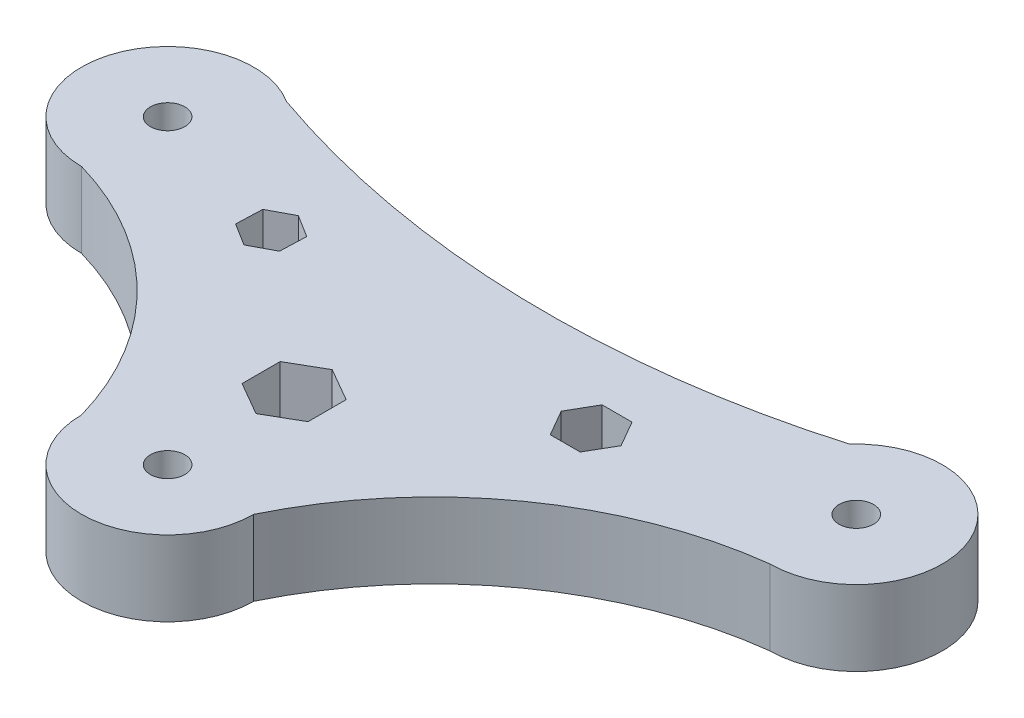
from build123d import *

# Parameters (mm, degrees)
BOSS_EXTRUDE2_OUTLINE_R = 1.6
BOSS_EXTRUDE2_DEPTH     = 7
CUT_EXTRUDE1_DEPTH      = 58.280013967


# Read off the part's stored shape, not the designer's step: Boss-Extrude2
with BuildPart() as part:
    # Boss-Extrude2 outline → Boss-Extrude2 (new body)
    with BuildSketch(Plane(origin=(0, 0, 0), x_dir=(1, 0, 0), z_dir=(0, 1, 0))):
        with BuildLine():
            ThreePointArc((36, 20), (43.304735803, 31.262029255), (30.042934529, 33.339791286))
            ThreePointArc((30.042934529, 33.339791286), (3.05899236, 29.845703842), (-23.704753961, 34.749137831))
            ThreePointArc((-23.704753961, 34.749137831), (-35.680921255, 30.236838992), (-28, 20))
            ThreePointArc((-28, 20), (-15.417509156, 12.586209164), (-7.999997816, 0.005911236))
            ThreePointArc((-7.999997816, 0.005911236), (-0.002955618, -7.999999454), (8, 0))
            ThreePointArc((8, 0), (19.451858394, 13.567398249), (36, 20))
        make_face()
        Circle(BOSS_EXTRUDE2_OUTLINE_R, mode=Mode.SUBTRACT)
        with Locations((-28, 28)):
            Circle(BOSS_EXTRUDE2_OUTLINE_R, mode=Mode.SUBTRACT)
        with Locations((36, 28)):
            Circle(BOSS_EXTRUDE2_OUTLINE_R, mode=Mode.SUBTRACT)
    extrude(amount=BOSS_EXTRUDE2_DEPTH)

    # Sketch5 → Cut-Extrude1 (cut, through all)
    with BuildSketch(Plane(origin=(0, 7, 0), x_dir=(1, 0, 0), z_dir=(0, 1, 0))):
        Polygon((-11.978854601, 22.378102142), (-11.893313223, 24.821105741), (-13.966245712, 26.116688546), (-16.124719579, 24.969267753), (-16.210260957, 22.526264155), (-14.137328468, 21.230681349), align=None)
        Polygon((19.546993666, 22.594588654), (18.156731561, 25.002593256), (15.37620735, 25.002593256), (13.985945245, 22.594588654), (15.37620735, 20.186584052), (18.156731561, 20.186584052), align=None)
        Polygon((0, 8.213063469), (3.066820834, 9.983693303), (3.066820834, 13.524952971), (0, 15.295582806), (-3.066820834, 13.524952971), (-3.066820834, 9.983693303), align=None)
    extrude(amount=-CUT_EXTRUDE1_DEPTH, mode=Mode.SUBTRACT)


solid = part.part
